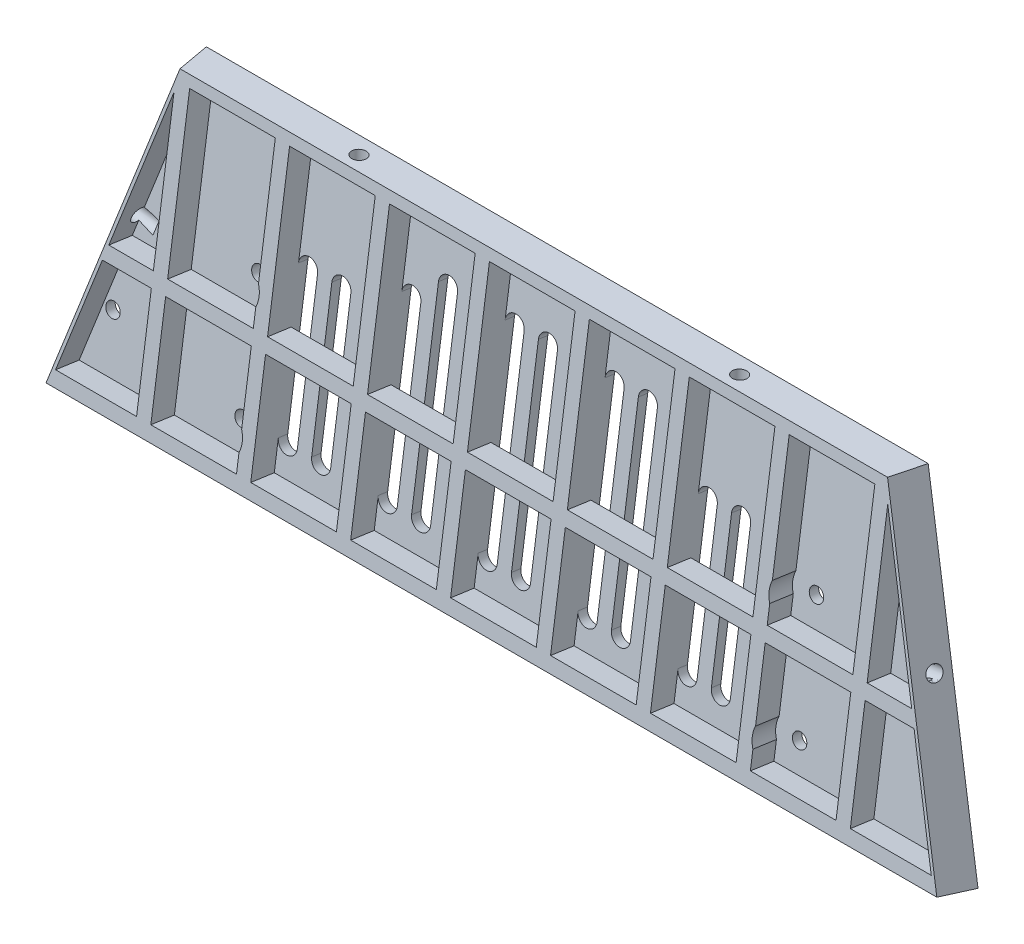
from build123d import *
from OCP.BRepFilletAPI import BRepFilletAPI_MakeChamfer

# Parameters (mm, degrees)
EXTRUDE_1_DEPTH          = 70
CHAMFER_1_SIZE           = 70
CHAMFER_1_SIZE_2         = 22.744378736
CUT_EXTRUDE_1_DEPTH      = 269.607520371
CUT_EXTRUDE_1_DEPTH_BACK = 269.607520371
CHAMFER_2_SIZE2          = 60
CHAMFER_2_SIZE           = 20
SKETCH_12_OUTSIDE_W      = 378.046
SKETCH_12_OUTSIDE_H      = 404.83
CUT_EXTRUDE_10_DEPTH     = 110
CUT_EXTRUDE_START        = -2
CUT_EXTRUDE_11_DEPTH     = 110
SKETCH_14_OUTSIDE_W      = 252.218
SKETCH_14_OUTSIDE_H      = 116.959
CUT_EXTRUDE_12_DEPTH     = 110
SKETCH_15_R              = 1.5
CUT_EXTRUDE_13_DEPTH     = 10
SKETCH_16_R              = 1.5
CUT_EXTRUDE_14_DEPTH     = 10
SKETCH_17_W              = 18
SKETCH_17_H              = 57.710678119
EXTRUDE_2_DEPTH          = 5
SKETCH_18_W              = 175.017782046
SKETCH_18_H              = 3
EXTRUDE_3_DEPTH          = 5
CHAMFER_3_SIZE           = 7
CHAMFER_3_SIZE_2         = 0.729554078
SKETCH_21_R              = 1.499999997
CUT_EXTRUDE_17_DEPTH     = 5
CHAMFER_4_SIZE           = 10
CHAMFER_4_SIZE_2         = 2.356529611
SKETCH_23_RX             = 1.5
SKETCH_23_RY             = 1.499995895
CUT_EXTRUDE_19_DEPTH     = 5
SKETCH_24_RX             = 1.5
SKETCH_24_RY             = 1.499995895
CUT_EXTRUDE_20_DEPTH     = 5


# Some blends are built 0.0001 mm under size
with BuildPart() as part:
    # 草图1 → 凸台-拉伸1 (new body)
    with BuildSketch(Plane.XY):
        Polygon((145, -15), (145, -95), (-145, -95), (-145, -15), (-85, 215), (85, 215), align=None)
    extrude(amount=-EXTRUDE_1_DEPTH)

    # 倒角1
    chamfer_1_edges_1 = [part.edges().sort_by_distance(p)[0] for p in [
        (115, 100, -70),
    ]]
    chamfer_1_side_1 = [part.faces().sort_by_distance(p)[0] for p in [
        (115, 100, -69.545112425),
    ]]
    chamfer_1_edges_2 = [part.edges().sort_by_distance(p)[0] for p in [
        (145, -55, -70),
    ]]
    chamfer_1_side_2 = [part.faces().sort_by_distance(p)[0] for p in [
        (145, -55, -69.545112425),
    ]]
    chamfer_1_edges_3 = [part.edges().sort_by_distance(p)[0] for p in [
        (-115, 100, -70),
    ]]
    chamfer_1_side_3 = [part.faces().sort_by_distance(p)[0] for p in [
        (-115, 100, -69.545112425),
    ]]
    chamfer_1_edges_4 = [part.edges().sort_by_distance(p)[0] for p in [
        (-145, -55, -70),
    ]]
    chamfer_1_side_4 = [part.faces().sort_by_distance(p)[0] for p in [
        (-145, -55, -69.545112425),
    ]]
    chamfer_1 = BRepFilletAPI_MakeChamfer(part.part.solid().wrapped)
    for e in chamfer_1_edges_1:
        chamfer_1.Add(CHAMFER_1_SIZE - 0.0001, CHAMFER_1_SIZE_2 - 0.0001, e.wrapped, chamfer_1_side_1[0].wrapped)
    for e in chamfer_1_edges_2:
        chamfer_1.Add(CHAMFER_1_SIZE - 0.0001, CHAMFER_1_SIZE_2 - 0.0001, e.wrapped, chamfer_1_side_2[0].wrapped)
    for e in chamfer_1_edges_3:
        chamfer_1.Add(CHAMFER_1_SIZE - 0.0001, CHAMFER_1_SIZE_2 - 0.0001, e.wrapped, chamfer_1_side_3[0].wrapped)
    for e in chamfer_1_edges_4:
        chamfer_1.Add(CHAMFER_1_SIZE - 0.0001, CHAMFER_1_SIZE_2 - 0.0001, e.wrapped, chamfer_1_side_4[0].wrapped)
    add(Compound.cast(chamfer_1.Shape()), mode=Mode.REPLACE)  # a hair under: the kernel refuses the full size

    # 草图2 → 切除-拉伸1 (cut, two sides: drawn at the far end of the back side and taken through both)
    with BuildSketch(Plane(origin=(0, 0, 0), x_dir=(0, 0, -1), z_dir=(1, 0, 0)).offset(-CUT_EXTRUDE_1_DEPTH_BACK)):
        Polygon((10, 215), (0, 145), (0, 215), align=None)
    extrude(amount=CUT_EXTRUDE_1_DEPTH + CUT_EXTRUDE_1_DEPTH_BACK, mode=Mode.SUBTRACT)

    # 倒角2
    chamfer_2_edges = [part.edges().sort_by_distance(p)[0] for p in [
        (0, 215, -70),
    ]]
    chamfer_2_side = [part.faces().sort_by_distance(p)[0] for p in [
        (0, 214.6, -70),
    ]]
    chamfer(chamfer_2_edges, length=CHAMFER_2_SIZE - 0.0001, length2=CHAMFER_2_SIZE2 - 0.0001, reference=chamfer_2_side[0])  # a hair under: the kernel refuses the full size

    # 草图12 outside → 切除-拉伸10 (cut)
    with BuildSketch(Plane(origin=(0, 2.9, 20.3), x_dir=(1, 0, 0), z_dir=(0, 0.14142135623730956, 0.9899494936611667))):
        with Locations((0, 64.347)):
            Rectangle(SKETCH_12_OUTSIDE_W, SKETCH_12_OUTSIDE_H)
        Polygon((81.642063908, 214.2533547), (-81.642063908, 214.2533547), (-103.260869565, 143.542676581), (103.260869565, 143.542676581), align=None, mode=Mode.SUBTRACT)
    extrude(amount=-CUT_EXTRUDE_10_DEPTH, mode=Mode.SUBTRACT)

    # 草图13 → 切除-拉伸11 (cut)
    with BuildSketch(Plane(origin=(0, 2.9, 20.3), x_dir=(1, 0, 0), z_dir=(0, 0.14142135623730956, 0.9899494936611667)).offset(CUT_EXTRUDE_START)):
        Polygon((81.642063908, 214.2533547), (-81.642063908, 214.2533547), (-103.260869565, 143.542676581), (103.260869565, 143.542676581), align=None)
    extrude(amount=-CUT_EXTRUDE_11_DEPTH, mode=Mode.SUBTRACT)

    # 草图14 outside → 切除-拉伸12 (cut)
    with BuildSketch(Plane(origin=(0, 2.9, 20.3), x_dir=(1, 0, 0), z_dir=(0, 0.14142135623730956, 0.9899494936611667))):
        with Locations((0, 178.8945)):
            Rectangle(SKETCH_14_OUTSIDE_W, SKETCH_14_OUTSIDE_H)
        Polygon((-76.590848222, 210.2533547), (-96.069501308, 146.542676581), (96.069501308, 146.542676581), (76.590848222, 210.2533547), align=None, mode=Mode.SUBTRACT)
    extrude(amount=-CUT_EXTRUDE_12_DEPTH, mode=Mode.SUBTRACT)

    # 草图15 → 切除-拉伸13 (cut)
    with BuildSketch(Plane(origin=(0, 2.9, 20.3), x_dir=(1, 0, 0), z_dir=(0, 0.14142135623730956, 0.9899494936611667))):
        with Locations(Location((77.715335497, 189.474145659, 0), (0, 0, 270))):
            Circle(SKETCH_15_R)
        with Locations(Location((86.486628321, 160.785046297, 0), (0, 0, 270))):
            Circle(SKETCH_15_R)
        with Locations(Location((-25, 205.2533547, 0), (0, 0, 270))):
            Circle(SKETCH_15_R)
        with Locations(Location((25, 205.2533547, 0), (0, 0, 270))):
            Circle(SKETCH_15_R)
        with Locations(Location((-86.486628321, 160.785046297, 0), (0, 0, 270))):
            Circle(SKETCH_15_R)
        with Locations(Location((-77.715335497, 189.474145659, 0), (0, 0, 270))):
            Circle(SKETCH_15_R)
        with BuildLine():
            Line((2, 195.542676581), (2, 155.542676581))
            ThreePointArc((2, 155.542676581), (0, 153.542676581), (-2, 155.542676581))
            Line((-2, 155.542676581), (-2, 195.542676581))
            ThreePointArc((-2, 195.542676581), (0, 197.542676581), (2, 195.542676581))
        make_face()
        with BuildLine():
            Line((5, 155.542676581), (5, 195.542676581))
            ThreePointArc((5, 195.542676581), (7, 197.542676581), (9, 195.542676581))
            Line((9, 195.542676581), (9, 155.542676581))
            ThreePointArc((9, 155.542676581), (7, 153.542676581), (5, 155.542676581))
        make_face()
        with BuildLine():
            Line((12, 155.542676581), (12, 195.542676581))
            ThreePointArc((12, 195.542676581), (14, 197.542676581), (16, 195.542676581))
            Line((16, 195.542676581), (16, 155.542676581))
            ThreePointArc((16, 155.542676581), (14, 153.542676581), (12, 155.542676581))
        make_face()
        with BuildLine():
            Line((19, 155.542676581), (19, 195.542676581))
            ThreePointArc((19, 195.542676581), (21, 197.542676581), (23, 195.542676581))
            Line((23, 195.542676581), (23, 155.542676581))
            ThreePointArc((23, 155.542676581), (21, 153.542676581), (19, 155.542676581))
        make_face()
        with BuildLine():
            Line((26, 155.542676581), (26, 190.542676581))
            ThreePointArc((26, 190.542676581), (28, 192.542676581), (30, 190.542676581))
            Line((30, 190.542676581), (30, 155.542676581))
            ThreePointArc((30, 155.542676581), (28, 153.542676581), (26, 155.542676581))
        make_face()
        with BuildLine():
            Line((33, 155.542676581), (33, 185.542676581))
            ThreePointArc((33, 185.542676581), (35, 187.542676581), (37, 185.542676581))
            Line((37, 185.542676581), (37, 155.542676581))
            ThreePointArc((37, 155.542676581), (35, 153.542676581), (33, 155.542676581))
        make_face()
        with BuildLine():
            Line((44, 185.542676581), (44, 155.542676581))
            ThreePointArc((44, 155.542676581), (42, 153.542676581), (40, 155.542676581))
            Line((40, 155.542676581), (40, 185.542676581))
            ThreePointArc((40, 185.542676581), (42, 187.542676581), (44, 185.542676581))
        make_face()
        with BuildLine():
            Line((51, 185.542676581), (51, 155.542676581))
            ThreePointArc((51, 155.542676581), (49, 153.542676581), (47, 155.542676581))
            Line((47, 155.542676581), (47, 185.542676581))
            ThreePointArc((47, 185.542676581), (49, 187.542676581), (51, 185.542676581))
        make_face()
    cut_extrude_13 = extrude(amount=-CUT_EXTRUDE_13_DEPTH, mode=Mode.SUBTRACT)

    # 草图16 → 切除-拉伸14 (cut)
    with BuildSketch(Plane(origin=(0, 2.9, 20.3), x_dir=(1, 0, 0), z_dir=(0, 0.14142135623730956, 0.9899494936611667))):
        with Locations(Location((58.590848222, 180.2533547, 0), (0, 0, 270))):
            Circle(SKETCH_16_R)
        with Locations(Location((58.590848222, 155.2533547, 0), (0, 0, 270))):
            Circle(SKETCH_16_R)
        with Locations(Location((-58.590848222, 155.2533547, 0), (0, 0, 270))):
            Circle(SKETCH_16_R)
        with Locations(Location((-58.590848222, 180.2533547, 0), (0, 0, 270))):
            Circle(SKETCH_16_R)
    extrude(amount=-CUT_EXTRUDE_14_DEPTH, mode=Mode.SUBTRACT)

    # 镜向2: 切除-拉伸13 across plane
    add(cut_extrude_13.mirror(Plane(origin=(0, 0, 0), x_dir=(0, 0, 1), z_dir=(1, 0, 0))), mode=Mode.SUBTRACT)

    # 草图17 → 凸台-拉伸2 (add)
    with BuildSketch(Plane(origin=(0, 2.9, 20.3), x_dir=(1, 0, 0), z_dir=(0, 0.1414213562373096, 0.9899494936611666))):
        Polygon((76.590848222, 210.2533547), (-76.590848222, 210.2533547), (-76.590848222, 207.2533547), (9, 207.2533547), (9, 149.542676581), (-95.152293063, 149.542676581), (-95.152293063, 146.542676581), (95.152293063, 146.542676581), (95.152293063, 149.542676581), align=None)
        with Locations((21, 178.398015641)):
            Rectangle(SKETCH_17_W, SKETCH_17_H, mode=Mode.SUBTRACT)
        with Locations((42, 178.398015641)):
            Rectangle(SKETCH_17_W, SKETCH_17_H, mode=Mode.SUBTRACT)
        with BuildLine():
            Line((54, 207.2533547), (72, 207.2533547))
            Line((72, 207.2533547), (72, 149.542676581))
            Line((72, 149.542676581), (54, 149.542676581))
            Line((54, 149.542676581), (54, 153.272417396))
            ThreePointArc((54, 153.272417396), (53.590848222, 155.2533547), (54, 157.234292003))
            Line((54, 157.234292003), (54, 178.272417396))
            ThreePointArc((54, 178.272417396), (53.590848222, 180.2533547), (54, 182.234292003))
            Line((54, 182.234292003), (54, 207.2533547))
        make_face(mode=Mode.SUBTRACT)
        Polygon((75, 149.542676581), (75, 205.19594775), (92.015213057, 149.542676581), align=None, mode=Mode.SUBTRACT)
    extrude_2 = extrude(amount=EXTRUDE_2_DEPTH)

    # 镜向4: 凸台-拉伸2 across plane
    add(extrude_2.mirror(Plane(origin=(0, 0, 0), x_dir=(0, 0, 1), z_dir=(1, 0, 0))))

    # 草图18 → 凸台-拉伸3 (add)
    with BuildSketch(Plane(origin=(0, 2.9, 20.3), x_dir=(1, 0, 0), z_dir=(0, 0.1414213562373096, 0.9899494936611666))):
        with Locations((0, 173.042676581)):
            Rectangle(SKETCH_18_W, SKETCH_18_H)
    extrude(amount=EXTRUDE_3_DEPTH)

    # 倒角3
    # the kernel refuses this chamfer: 7, 0.729554078 mm, written as the material it takes off along each edge
    with BuildSketch(Plane(origin=(94.787221817, 211.747308807, -4.484567107), x_dir=(0, -0.13747257218178818, -0.9905055738852372), z_dir=(-1, 0, 0))) as chamfer_3_piece_1:
        Polygon((CHAMFER_3_SIZE * 0.99999204894, CHAMFER_3_SIZE * 0.0039877383958), (-CHAMFER_3_SIZE_2 * 0.00398773839397, CHAMFER_3_SIZE_2 * 0.999992048479), (0, 0), align=None)
    extrude(amount=189.574443634, mode=Mode.SUBTRACT)

    # 草图21 → 切除-拉伸17 (cut)
    with BuildSketch(Plane(origin=(0, 210.886263428, -8.028089484), x_dir=(1, 0, 0), z_dir=(0, 0.9992761874498873, -0.038040783320245394))):
        with Locations(Location((40, -0.386756856, 0), (0, 0, 270))):
            Circle(SKETCH_21_R)
        with Locations(Location((-40, -0.386756856, 0), (0, 0, 270))):
            Circle(SKETCH_21_R)
    extrude(amount=-CUT_EXTRUDE_17_DEPTH, mode=Mode.SUBTRACT)

    # 倒角4
    # the kernel refuses this chamfer: 10, 2.356529611 mm, written as the material it takes off along each edge
    with BuildSketch(Plane(origin=(87.508891023, 176.395541085, 0.565685425), x_dir=(0.008444774785247095, -0.1388599188622743, -0.9902760265261342), z_dir=(-0.29237642747779213, 0.9466919795594642, -0.1352417113656378))) as chamfer_4_piece_1:
        Polygon((CHAMFER_4_SIZE * 0.999961009097, CHAMFER_4_SIZE * 0.00883064471152), (-CHAMFER_4_SIZE_2 * 0.00883064470971, CHAMFER_4_SIZE_2 * 0.999961008891), (0, 0), align=None)
    extrude(amount=62.553880277, mode=Mode.SUBTRACT)
    with BuildSketch(Plane(origin=(-87.508891023, 176.395541085, 0.565685425), x_dir=(-0.008444774785244101, -0.13885991886227525, -0.9902760265261342), z_dir=(0.2923764274777921, 0.9466919795594642, -0.1352417113656378))) as chamfer_4_piece_2:
        Polygon((CHAMFER_4_SIZE * 0.999961009097, -CHAMFER_4_SIZE * 0.00883064471152), (-CHAMFER_4_SIZE_2 * 0.00883064470971, -CHAMFER_4_SIZE_2 * 0.999961008891), (0, 0), align=None)
    extrude(amount=62.553880277, mode=Mode.SUBTRACT)
    with BuildSketch(Plane(origin=(-102.746581308, 127.057093027, 7.614035148), x_dir=(-0.008444774785248717, -0.13885991886227383, -0.9902760265261343), z_dir=(0.2923764274777921, 0.9466919795594642, -0.1352417113656378))) as chamfer_4_piece_3:
        Polygon((CHAMFER_4_SIZE * 0.999961009097, -CHAMFER_4_SIZE * 0.00883064471152), (-CHAMFER_4_SIZE_2 * 0.00883064470971, -CHAMFER_4_SIZE_2 * 0.999961008891), (0, 0), align=None)
    extrude(amount=52.116685388, mode=Mode.SUBTRACT)
    with BuildSketch(Plane(origin=(102.746581308, 127.057093027, 7.614035148), x_dir=(0.008444774785248249, -0.138859918862274, -0.9902760265261343), z_dir=(-0.29237642747779213, 0.9466919795594642, -0.1352417113656378))) as chamfer_4_piece_4:
        Polygon((CHAMFER_4_SIZE * 0.999961009097, CHAMFER_4_SIZE * 0.00883064471152), (-CHAMFER_4_SIZE_2 * 0.00883064470971, CHAMFER_4_SIZE_2 * 0.999961008891), (0, 0), align=None)
    extrude(amount=52.116685388, mode=Mode.SUBTRACT)

    # 草图23 → 切除-拉伸19 (cut)
    with BuildSketch(Plane(origin=(-125.363189662, 42.311635172, 25.161202813), x_dir=(0.17700898056926198, -0.059742731723343455, 0.9823943336583651), z_dir=(-0.9308075395625836, 0.31415911748270614, 0.18681909216120485))):
        with Locations(Location((-29.723962901, 144.092874307), (0, 0, -170.717269882))):
            Ellipse(SKETCH_23_RX, SKETCH_23_RY)
    extrude(amount=-CUT_EXTRUDE_19_DEPTH, mode=Mode.SUBTRACT)

    # 草图24 → 切除-拉伸20 (cut)
    with BuildSketch(Plane(origin=(125.363189662, 42.311635172, 25.161202813), x_dir=(0.17700898056926295, 0.05974273172334392, -0.9823943336583649), z_dir=(0.9308075395625832, 0.3141591174827067, 0.18681909216120596))):
        with Locations(Location((29.723962901, 144.092874307), (0, 0, -9.282730118))):
            Ellipse(SKETCH_24_RX, SKETCH_24_RY)
    extrude(amount=-CUT_EXTRUDE_20_DEPTH, mode=Mode.SUBTRACT)


solid = part.part
